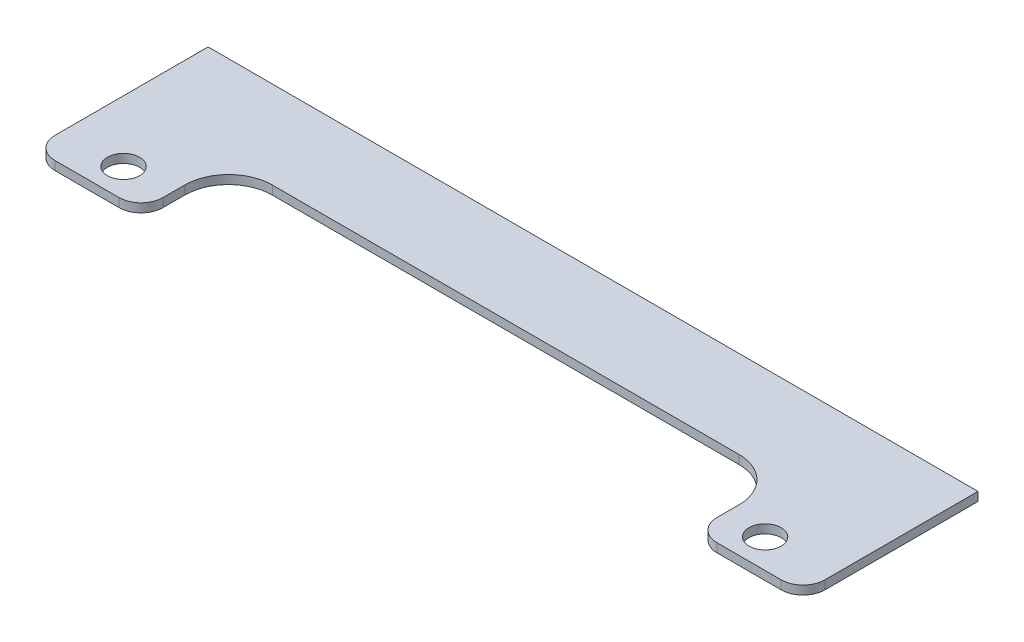
from build123d import *

# Parameters (mm, degrees)
EXTRUDE_1_DEPTH          = 6
CUT_EXTRUDE_1_DEPTH      = 14
CUT_EXTRUDE_1_DEPTH_BACK = 5
SKETCH_7_R               = 11
CUT_EXTRUDE_2_DEPTH      = 11
CUT_EXTRUDE_2_DEPTH_BACK = 5
SKETCH_8_R               = 11


with BuildPart() as part:
    # Эскиз1 → Бобышка-Вытянуть1 (new body)
    with BuildSketch(Plane(origin=(0, 0, 0), x_dir=(1, 0, 0), z_dir=(0, 1, 0))):
        with BuildLine():
            Line((-338.202898551, 15), (-338.202898551, 120))
            Line((-338.202898551, 120), (189.797101449, 120))
            Line((189.797101449, 120), (189.797101449, 15))
            ThreePointArc((189.797101449, 15), (185.403703167, 4.393398282), (174.797101449, 0))
            Line((174.797101449, 0), (130.797101449, 0))
            ThreePointArc((130.797101449, 0), (120.190499731, 4.393398282), (115.797101449, 15))
            Line((115.797101449, 15), (115.797101449, 30))
            ThreePointArc((115.797101449, 30), (107.010304885, 51.213203436), (85.797101449, 60))
            Line((85.797101449, 60), (-234.202898551, 60))
            ThreePointArc((-234.202898551, 60), (-255.416101986, 51.213203436), (-264.202898551, 30))
            Line((-264.202898551, 30), (-264.202898551, 15))
            ThreePointArc((-264.202898551, 15), (-268.596296833, 4.393398282), (-279.202898551, 0))
            Line((-279.202898551, 0), (-323.202898551, 0))
            ThreePointArc((-323.202898551, 0), (-333.809500269, 4.393398282), (-338.202898551, 15))
        make_face()
    extrude(amount=EXTRUDE_1_DEPTH)

    # Эскиз7 → Вырез-Вытянуть1 (cut, two sides: drawn at the far end of the back side and taken through both)
    with BuildSketch(Plane(origin=(0, 0, 0), x_dir=(1, 0, 0), z_dir=(0, 1, 0)).offset(-CUT_EXTRUDE_1_DEPTH_BACK)):
        with Locations((-296.202898551, 20)):
            Circle(SKETCH_7_R)
    extrude(amount=CUT_EXTRUDE_1_DEPTH + CUT_EXTRUDE_1_DEPTH_BACK, mode=Mode.SUBTRACT)

    # Эскиз8 → Вырез-Вытянуть2 (cut, two sides: drawn at the far end of the back side and taken through both)
    with BuildSketch(Plane(origin=(0, 0, 0), x_dir=(1, 0, 0), z_dir=(0, 1, 0)).offset(-CUT_EXTRUDE_2_DEPTH_BACK)):
        with Locations((143.797101449, 20)):
            Circle(SKETCH_8_R)
    extrude(amount=CUT_EXTRUDE_2_DEPTH + CUT_EXTRUDE_2_DEPTH_BACK, mode=Mode.SUBTRACT)


solid = part.part
